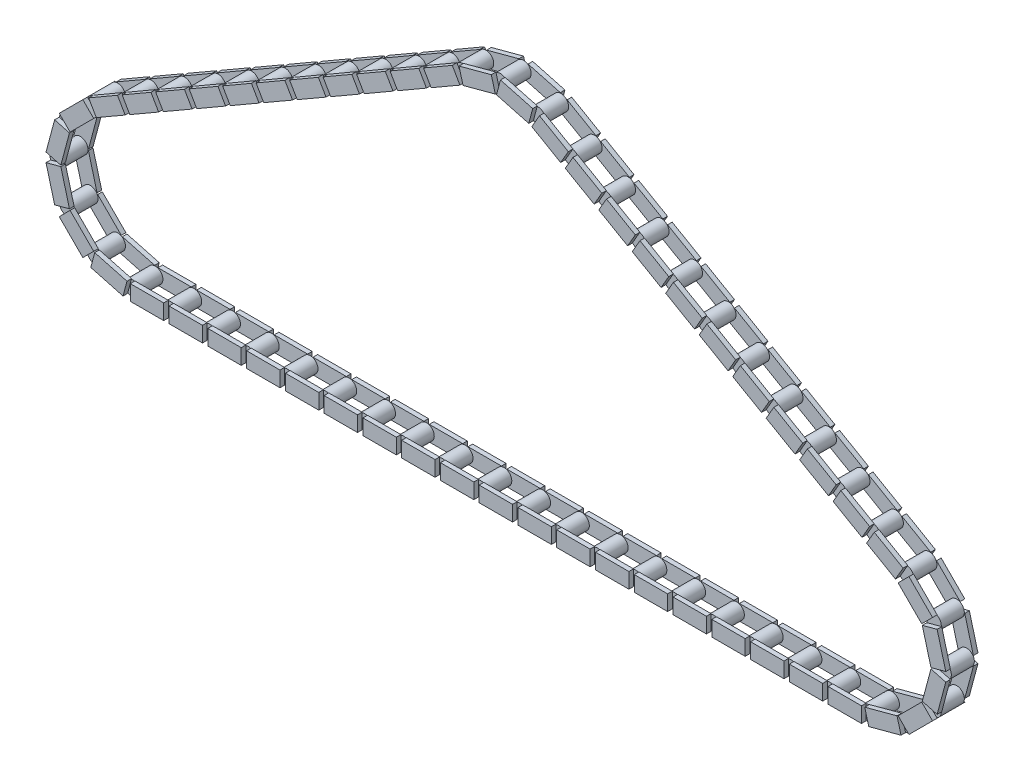
from build123d import *

# Parameters (mm, degrees)
BOTTOM_LINK_PLATES_DEPTH    = 1.2
BOTTOM_LINK_PLATES_2_DEPTH  = 1.2
BOTTOM_LINK_PLATES_3_DEPTH  = 1.2
BOTTOM_LINK_PLATES_4_DEPTH  = 1.2
BOTTOM_LINK_PLATES_5_DEPTH  = 1.2
BOTTOM_LINK_PLATES_6_DEPTH  = 1.2
BOTTOM_LINK_PLATES_7_DEPTH  = 1.2
BOTTOM_LINK_PLATES_8_DEPTH  = 1.2
BOTTOM_LINK_PLATES_9_DEPTH  = 1.2
BOTTOM_LINK_PLATES_10_DEPTH = 1.2
BOTTOM_LINK_PLATES_11_DEPTH = 1.2
BOTTOM_LINK_PLATES_12_DEPTH = 1.2
BOTTOM_LINK_PLATES_13_DEPTH = 1.2
BOTTOM_LINK_PLATES_14_DEPTH = 1.2
BOTTOM_LINK_PLATES_15_DEPTH = 1.2
BOTTOM_LINK_PLATES_16_DEPTH = 1.2
BOTTOM_LINK_PLATES_17_DEPTH = 1.2
BOTTOM_LINK_PLATES_18_DEPTH = 1.2
BOTTOM_LINK_PLATES_19_DEPTH = 1.2
BOTTOM_LINK_PLATES_20_DEPTH = 1.2
BOTTOM_LINK_PLATES_21_DEPTH = 1.2
BOTTOM_LINK_PLATES_22_DEPTH = 1.2
BOTTOM_LINK_PLATES_23_DEPTH = 1.2
BOTTOM_LINK_PLATES_24_DEPTH = 1.2
BOTTOM_LINK_PLATES_25_DEPTH = 1.2
BOTTOM_LINK_PLATES_26_DEPTH = 1.2
BOTTOM_LINK_PLATES_27_DEPTH = 1.2
BOTTOM_LINK_PLATES_28_DEPTH = 1.2
BOTTOM_LINK_PLATES_29_DEPTH = 1.2
BOTTOM_LINK_PLATES_30_DEPTH = 1.2
BOTTOM_LINK_PLATES_31_DEPTH = 1.2
BOTTOM_LINK_PLATES_32_DEPTH = 1.2
BOTTOM_LINK_PLATES_33_DEPTH = 1.2
BOTTOM_LINK_PLATES_34_DEPTH = 1.2
SKETCH_1_W                  = 8.705263365
SKETCH_1_H                  = 4
BOTTOM_LINK_PLATES_35_DEPTH = 1.2
BOTTOM_LINK_PLATES_36_DEPTH = 1.2
SKETCH_1_W_2                = 8.705263366
BOTTOM_LINK_PLATES_37_DEPTH = 1.2
BOTTOM_LINK_PLATES_38_DEPTH = 1.2
BOTTOM_LINK_PLATES_39_DEPTH = 1.2
BOTTOM_LINK_PLATES_40_DEPTH = 1.2
BOTTOM_LINK_PLATES_41_DEPTH = 1.2
BOTTOM_LINK_PLATES_42_DEPTH = 1.2
BOTTOM_LINK_PLATES_43_DEPTH = 1.2
BOTTOM_LINK_PLATES_44_DEPTH = 1.2
BOTTOM_LINK_PLATES_45_DEPTH = 1.2
BOTTOM_LINK_PLATES_46_DEPTH = 1.2
BOTTOM_LINK_PLATES_47_DEPTH = 1.2
BOTTOM_LINK_PLATES_48_DEPTH = 1.2
BOTTOM_LINK_PLATES_49_DEPTH = 1.2
BOTTOM_LINK_PLATES_50_DEPTH = 1.2
BOTTOM_LINK_PLATES_51_DEPTH = 1.2
BOTTOM_LINK_PLATES_52_DEPTH = 1.2
BOTTOM_LINK_PLATES_53_DEPTH = 1.2
SKETCH_3_R                  = 2
ROLLERS_DEPTH               = 6
SKETCH_5_W                  = 8.705263365
SKETCH_5_H                  = 4
SKETCH_5_W_2                = 8.705263366
TOP_LINK_PLATES_DEPTH       = 1.2


with BuildPart() as part:
    # 草图1 → Bottom_link_plates (new body)
    with BuildSketch(Plane.XY):
        Polygon((-97.193786169, -21.272547652), (-105.602424677, -19.019459754), (-104.567148497, -15.155756449), (-96.158509988, -17.408844347), align=None)
    extrude(amount=BOTTOM_LINK_PLATES_DEPTH)



with BuildPart() as body_2:
    # 草图1 → Bottom_link_plates 2 (new body)
    with BuildSketch(Plane.XY):
        Polygon((-107.670122975, -17.825673586), (-113.825673586, -11.670122975), (-110.997246461, -8.84169585), (-104.84169585, -14.997246461), align=None)
    extrude(amount=BOTTOM_LINK_PLATES_2_DEPTH)


with BuildPart() as body_3:
    # 草图1 → Bottom_link_plates 3 (new body)
    with BuildSketch(Plane.XY):
        Polygon((-115.019459754, -9.602424677), (-117.272547652, -1.193786169), (-113.408844347, -0.158509988), (-111.155756449, -8.567148497), align=None)
    extrude(amount=BOTTOM_LINK_PLATES_3_DEPTH)


with BuildPart() as body_4:
    # 草图1 → Bottom_link_plates 4 (new body)
    with BuildSketch(Plane.XY):
        Polygon((-117.272547652, 1.193786169), (-115.019459754, 9.602424677), (-111.155756449, 8.567148497), (-113.408844347, 0.158509988), align=None)
    extrude(amount=BOTTOM_LINK_PLATES_4_DEPTH)


with BuildPart() as body_5:
    # 草图1 → Bottom_link_plates 5 (new body)
    with BuildSketch(Plane.XY):
        Polygon((-113.825673586, 11.670122975), (-107.670122975, 17.825673586), (-104.84169585, 14.997246461), (-110.997246461, 8.84169585), align=None)
    extrude(amount=BOTTOM_LINK_PLATES_5_DEPTH)


with BuildPart() as body_6:
    # 草图1 → Bottom_link_plates 6 (new body)
    with BuildSketch(Plane.XY):
        Polygon((-106.154716463, 18.988485657), (-98.639879132, 23.32717699), (-96.639879831, 19.863074971), (-104.154717162, 15.524383638), align=None)
    extrude(amount=BOTTOM_LINK_PLATES_6_DEPTH)


with BuildPart() as body_7:
    # 草图1 → Bottom_link_plates 7 (new body)
    with BuildSketch(Plane.XY):
        Polygon((-97.427443425, 24.027176746), (-89.912606094, 28.365868079), (-87.912606794, 24.90176606), (-95.427444124, 20.563074727), align=None)
    extrude(amount=BOTTOM_LINK_PLATES_7_DEPTH)


with BuildPart() as body_8:
    # 草图1 → Bottom_link_plates 8 (new body)
    with BuildSketch(Plane.XY):
        Polygon((-88.700170388, 29.065867834), (-81.185333057, 33.404559167), (-79.185333756, 29.940457148), (-86.700171087, 25.601765815), align=None)
    extrude(amount=BOTTOM_LINK_PLATES_8_DEPTH)


with BuildPart() as body_9:
    # 草图1 → Bottom_link_plates 9 (new body)
    with BuildSketch(Plane.XY):
        Polygon((-79.97289735, 34.104558922), (-72.458060019, 38.443250255), (-70.458060718, 34.979148236), (-77.972898049, 30.640456903), align=None)
    extrude(amount=BOTTOM_LINK_PLATES_9_DEPTH)


with BuildPart() as body_10:
    # 草图1 → Bottom_link_plates 10 (new body)
    with BuildSketch(Plane.XY):
        Polygon((-71.245624312, 39.14325001), (-63.730786981, 43.481941343), (-61.730787681, 40.017839324), (-69.245625012, 35.679147991), align=None)
    extrude(amount=BOTTOM_LINK_PLATES_10_DEPTH)


with BuildPart() as body_11:
    # 草图1 → Bottom_link_plates 11 (new body)
    with BuildSketch(Plane.XY):
        Polygon((-62.518351275, 44.181941099), (-55.003513944, 48.520632432), (-53.003514643, 45.056530413), (-60.518351974, 40.71783908), align=None)
    extrude(amount=BOTTOM_LINK_PLATES_11_DEPTH)


with BuildPart() as body_12:
    # 草图1 → Bottom_link_plates 12 (new body)
    with BuildSketch(Plane.XY):
        Polygon((-53.791078237, 49.220632187), (-46.276240906, 53.55932352), (-44.276241606, 50.095221501), (-51.791078937, 45.756530168), align=None)
    extrude(amount=BOTTOM_LINK_PLATES_12_DEPTH)


with BuildPart() as body_13:
    # 草图1 → Bottom_link_plates 13 (new body)
    with BuildSketch(Plane.XY):
        Polygon((-45.0638052, 54.259323275), (-37.548967869, 58.598014608), (-35.548968568, 55.133912589), (-43.063805899, 50.795221256), align=None)
    extrude(amount=BOTTOM_LINK_PLATES_13_DEPTH)


with BuildPart() as body_14:
    # 草图1 → Bottom_link_plates 14 (new body)
    with BuildSketch(Plane.XY):
        Polygon((-36.336532162, 59.298014363), (-28.821694831, 63.636705696), (-26.821695531, 60.172603677), (-34.336532861, 55.833912344), align=None)
    extrude(amount=BOTTOM_LINK_PLATES_14_DEPTH)


with BuildPart() as body_15:
    # 草图1 → Bottom_link_plates 15 (new body)
    with BuildSketch(Plane.XY):
        Polygon((-27.609259125, 64.336705452), (-20.094421794, 68.675396785), (-18.094422493, 65.211294766), (-25.609259824, 60.872603433), align=None)
    extrude(amount=BOTTOM_LINK_PLATES_15_DEPTH)


with BuildPart() as body_16:
    # 草图1 → Bottom_link_plates 16 (new body)
    with BuildSketch(Plane.XY):
        Polygon((-18.881986087, 69.37539654), (-11.367148756, 73.714087873), (-9.367149455, 70.249985854), (-16.881986786, 65.911294521), align=None)
    extrude(amount=BOTTOM_LINK_PLATES_16_DEPTH)


with BuildPart() as body_17:
    # 草图1 → Bottom_link_plates 17 (new body)
    with BuildSketch(Plane.XY):
        Polygon((-9.602420838, 74.445061693), (-1.193781874, 76.698147893), (-0.158506473, 72.834444379), (-8.567145437, 70.581358179), align=None)
    extrude(amount=BOTTOM_LINK_PLATES_17_DEPTH)


with BuildPart() as body_18:
    # 草图1 → Bottom_link_plates 18 (new body)
    with BuildSketch(Plane.XY):
        Polygon((1.193790463, 76.698147411), (9.602428517, 74.445057816), (8.567151557, 70.58135472), (0.158513503, 72.834444315), align=None)
    extrude(amount=BOTTOM_LINK_PLATES_18_DEPTH)


with BuildPart() as body_19:
    # 草图1 → Bottom_link_plates 19 (new body)
    with BuildSketch(Plane.XY):
        Polygon((11.367155583, 73.714083931), (18.881991983, 69.375393136), (16.881992682, 65.911291117), (9.367156282, 70.249981913), align=None)
    extrude(amount=BOTTOM_LINK_PLATES_19_DEPTH)


with BuildPart() as body_20:
    # 草图1 → Bottom_link_plates 20 (new body)
    with BuildSketch(Plane.XY):
        Polygon((20.094427689, 68.675393381), (27.609264089, 64.336702585), (25.609264789, 60.872600566), (18.094428389, 65.211291362), align=None)
    extrude(amount=BOTTOM_LINK_PLATES_20_DEPTH)


with BuildPart() as body_21:
    # 草图1 → Bottom_link_plates 21 (new body)
    with BuildSketch(Plane.XY):
        Polygon((28.821699796, 63.63670283), (36.336536196, 59.298012034), (34.336536895, 55.833910015), (26.821700495, 60.172600811), align=None)
    extrude(amount=BOTTOM_LINK_PLATES_21_DEPTH)


with BuildPart() as body_22:
    # 草图1 → Bottom_link_plates 22 (new body)
    with BuildSketch(Plane.XY):
        Polygon((37.548971903, 58.598012279), (45.063808303, 54.259321484), (43.063809002, 50.795219465), (35.548972602, 55.13391026), align=None)
    extrude(amount=BOTTOM_LINK_PLATES_22_DEPTH)


with BuildPart() as body_23:
    # 草图1 → Bottom_link_plates 23 (new body)
    with BuildSketch(Plane.XY):
        Polygon((46.276244009, 53.559321728), (53.791080409, 49.220630933), (51.791081109, 45.756528914), (44.276244709, 50.095219709), align=None)
    extrude(amount=BOTTOM_LINK_PLATES_23_DEPTH)


with BuildPart() as body_24:
    # 草图1 → Bottom_link_plates 24 (new body)
    with BuildSketch(Plane.XY):
        Polygon((55.003516116, 48.520631178), (62.518352516, 44.181940382), (60.518353215, 40.717838363), (53.003516815, 45.056529159), align=None)
    extrude(amount=BOTTOM_LINK_PLATES_24_DEPTH)


with BuildPart() as body_25:
    # 草图1 → Bottom_link_plates 25 (new body)
    with BuildSketch(Plane.XY):
        Polygon((63.730788223, 43.481940627), (71.245624623, 39.143249831), (69.245625322, 35.679147812), (61.730788922, 40.017838608), align=None)
    extrude(amount=BOTTOM_LINK_PLATES_25_DEPTH)


with BuildPart() as body_26:
    # 草图1 → Bottom_link_plates 26 (new body)
    with BuildSketch(Plane.XY):
        Polygon((72.458060329, 38.443250076), (79.972896729, 34.10455928), (77.972897429, 30.640457261), (70.458061029, 34.979148057), align=None)
    extrude(amount=BOTTOM_LINK_PLATES_26_DEPTH)


with BuildPart() as body_27:
    # 草图1 → Bottom_link_plates 27 (new body)
    with BuildSketch(Plane.XY):
        Polygon((81.185332436, 33.404559525), (88.700168836, 29.06586873), (86.700169535, 25.601766711), (79.185333135, 29.940457506), align=None)
    extrude(amount=BOTTOM_LINK_PLATES_27_DEPTH)


with BuildPart() as body_28:
    # 草图1 → Bottom_link_plates 28 (new body)
    with BuildSketch(Plane.XY):
        Polygon((89.912604543, 28.365868974), (97.427440943, 24.027178179), (95.427441642, 20.56307616), (87.912605242, 24.901766955), align=None)
    extrude(amount=BOTTOM_LINK_PLATES_28_DEPTH)


with BuildPart() as body_29:
    # 草图1 → Bottom_link_plates 29 (new body)
    with BuildSketch(Plane.XY):
        Polygon((98.639876649, 23.327178424), (106.154713049, 18.988487628), (104.154713749, 15.524385609), (96.639877349, 19.863076405), align=None)
    extrude(amount=BOTTOM_LINK_PLATES_29_DEPTH)


with BuildPart() as body_30:
    # 草图1 → Bottom_link_plates 30 (new body)
    with BuildSketch(Plane.XY):
        Polygon((107.670119376, 17.825675942), (113.82567123, 11.670126574), (110.997244676, 8.841698878), (104.841692822, 14.997248246), align=None)
    extrude(amount=BOTTOM_LINK_PLATES_30_DEPTH)


with BuildPart() as body_31:
    # 草图1 → Bottom_link_plates 31 (new body)
    with BuildSketch(Plane.XY):
        Polygon((115.019457816, 9.602428517), (117.272547411, 1.193790463), (113.408844315, 0.158513503), (111.15575472, 8.567151557), align=None)
    extrude(amount=BOTTOM_LINK_PLATES_31_DEPTH)


with BuildPart() as body_32:
    # 草图1 → Bottom_link_plates 32 (new body)
    with BuildSketch(Plane.XY):
        Polygon((117.272547893, -1.193781874), (115.019461693, -9.602420838), (111.155758179, -8.567145437), (113.408844379, -0.158506473), align=None)
    extrude(amount=BOTTOM_LINK_PLATES_32_DEPTH)


with BuildPart() as body_33:
    # 草图1 → Bottom_link_plates 33 (new body)
    with BuildSketch(Plane.XY):
        Polygon((113.825675942, -11.670119376), (107.670126574, -17.82567123), (104.841698878, -14.997244676), (110.997248246, -8.841692822), align=None)
    extrude(amount=BOTTOM_LINK_PLATES_33_DEPTH)


with BuildPart() as body_34:
    # 草图1 → Bottom_link_plates 34 (new body)
    with BuildSketch(Plane.XY):
        Polygon((105.602428517, -19.019457816), (97.193790463, -21.272547411), (96.158513503, -17.408844315), (104.567151557, -15.15575472), align=None)
    extrude(amount=BOTTOM_LINK_PLATES_34_DEPTH)


with BuildPart() as body_35:
    # 草图1 → Bottom_link_plates 35 (new body)
    with BuildSketch(Plane.XY):
        with Locations((90.947372258, -19.521869331)):
            Rectangle(SKETCH_1_W, SKETCH_1_H)
    extrude(amount=BOTTOM_LINK_PLATES_35_DEPTH)


with BuildPart() as body_36:
    # 草图1 → Bottom_link_plates 36 (new body)
    with BuildSketch(Plane.XY):
        with Locations((80.842108894, -19.521869331)):
            Rectangle(SKETCH_1_W, SKETCH_1_H)
    extrude(amount=BOTTOM_LINK_PLATES_36_DEPTH)


with BuildPart() as body_37:
    # 草图1 → Bottom_link_plates 37 (new body)
    with BuildSketch(Plane.XY):
        with Locations((70.736845528, -19.521869331)):
            Rectangle(SKETCH_1_W_2, SKETCH_1_H)
    extrude(amount=BOTTOM_LINK_PLATES_37_DEPTH)


with BuildPart() as body_38:
    # 草图1 → Bottom_link_plates 38 (new body)
    with BuildSketch(Plane.XY):
        with Locations((60.631582163, -19.521869331)):
            Rectangle(SKETCH_1_W, SKETCH_1_H)
    extrude(amount=BOTTOM_LINK_PLATES_38_DEPTH)


with BuildPart() as body_39:
    # 草图1 → Bottom_link_plates 39 (new body)
    with BuildSketch(Plane.XY):
        with Locations((50.526318797, -19.521869331)):
            Rectangle(SKETCH_1_W, SKETCH_1_H)
    extrude(amount=BOTTOM_LINK_PLATES_39_DEPTH)


with BuildPart() as body_40:
    # 草图1 → Bottom_link_plates 40 (new body)
    with BuildSketch(Plane.XY):
        with Locations((40.421055432, -19.521869331)):
            Rectangle(SKETCH_1_W_2, SKETCH_1_H)
    extrude(amount=BOTTOM_LINK_PLATES_40_DEPTH)


with BuildPart() as body_41:
    # 草图1 → Bottom_link_plates 41 (new body)
    with BuildSketch(Plane.XY):
        with Locations((30.315792067, -19.521869331)):
            Rectangle(SKETCH_1_W, SKETCH_1_H)
    extrude(amount=BOTTOM_LINK_PLATES_41_DEPTH)


with BuildPart() as body_42:
    # 草图1 → Bottom_link_plates 42 (new body)
    with BuildSketch(Plane.XY):
        with Locations((20.210528702, -19.521869331)):
            Rectangle(SKETCH_1_W, SKETCH_1_H)
    extrude(amount=BOTTOM_LINK_PLATES_42_DEPTH)


with BuildPart() as body_43:
    # 草图1 → Bottom_link_plates 43 (new body)
    with BuildSketch(Plane.XY):
        with Locations((10.105265336, -19.521869331)):
            Rectangle(SKETCH_1_W_2, SKETCH_1_H)
    extrude(amount=BOTTOM_LINK_PLATES_43_DEPTH)


with BuildPart() as body_44:
    # 草图1 → Bottom_link_plates 44 (new body)
    with BuildSketch(Plane.XY):
        with Locations((1.971e-06, -19.521869331)):
            Rectangle(SKETCH_1_W, SKETCH_1_H)
    extrude(amount=BOTTOM_LINK_PLATES_44_DEPTH)


with BuildPart() as body_45:
    # 草图1 → Bottom_link_plates 45 (new body)
    with BuildSketch(Plane.XY):
        with Locations((-10.105261395, -19.521869331)):
            Rectangle(SKETCH_1_W, SKETCH_1_H)
    extrude(amount=BOTTOM_LINK_PLATES_45_DEPTH)


with BuildPart() as body_46:
    # 草图1 → Bottom_link_plates 46 (new body)
    with BuildSketch(Plane.XY):
        with Locations((-20.21052476, -19.521869331)):
            Rectangle(SKETCH_1_W_2, SKETCH_1_H)
    extrude(amount=BOTTOM_LINK_PLATES_46_DEPTH)


with BuildPart() as body_47:
    # 草图1 → Bottom_link_plates 47 (new body)
    with BuildSketch(Plane.XY):
        with Locations((-30.315788126, -19.521869331)):
            Rectangle(SKETCH_1_W, SKETCH_1_H)
    extrude(amount=BOTTOM_LINK_PLATES_47_DEPTH)


with BuildPart() as body_48:
    # 草图1 → Bottom_link_plates 48 (new body)
    with BuildSketch(Plane.XY):
        with Locations((-40.421051491, -19.521869331)):
            Rectangle(SKETCH_1_W, SKETCH_1_H)
    extrude(amount=BOTTOM_LINK_PLATES_48_DEPTH)


with BuildPart() as body_49:
    # 草图1 → Bottom_link_plates 49 (new body)
    with BuildSketch(Plane.XY):
        with Locations((-50.526314856, -19.521869331)):
            Rectangle(SKETCH_1_W_2, SKETCH_1_H)
    extrude(amount=BOTTOM_LINK_PLATES_49_DEPTH)


with BuildPart() as body_50:
    # 草图1 → Bottom_link_plates 50 (new body)
    with BuildSketch(Plane.XY):
        with Locations((-60.631578222, -19.521869331)):
            Rectangle(SKETCH_1_W, SKETCH_1_H)
    extrude(amount=BOTTOM_LINK_PLATES_50_DEPTH)


with BuildPart() as body_51:
    # 草图1 → Bottom_link_plates 51 (new body)
    with BuildSketch(Plane.XY):
        with Locations((-70.736841587, -19.521869331)):
            Rectangle(SKETCH_1_W, SKETCH_1_H)
    extrude(amount=BOTTOM_LINK_PLATES_51_DEPTH)


with BuildPart() as body_52:
    # 草图1 → Bottom_link_plates 52 (new body)
    with BuildSketch(Plane.XY):
        with Locations((-80.842104952, -19.521869331)):
            Rectangle(SKETCH_1_W_2, SKETCH_1_H)
    extrude(amount=BOTTOM_LINK_PLATES_52_DEPTH)


with BuildPart() as body_53:
    # 草图1 → Bottom_link_plates 53 (new body)
    with BuildSketch(Plane.XY):
        with Locations((-90.947368318, -19.521869331)):
            Rectangle(SKETCH_1_W, SKETCH_1_H)
    extrude(amount=BOTTOM_LINK_PLATES_53_DEPTH)


with BuildPart() as part_1:
    add(part.part)

    add(body_2.part)  # Rollers merges body 2

    add(body_3.part)  # Rollers merges body 3

    add(body_4.part)  # Rollers merges body 4

    add(body_5.part)  # Rollers merges body 5

    add(body_6.part)  # Rollers merges body 6

    add(body_7.part)  # Rollers merges body 7

    add(body_8.part)  # Rollers merges body 8

    add(body_9.part)  # Rollers merges body 9

    add(body_10.part)  # Rollers merges body 10

    add(body_11.part)  # Rollers merges body 11

    add(body_12.part)  # Rollers merges body 12

    add(body_13.part)  # Rollers merges body 13

    add(body_14.part)  # Rollers merges body 14

    add(body_15.part)  # Rollers merges body 15

    add(body_16.part)  # Rollers merges body 16

    add(body_17.part)  # Rollers merges body 17

    add(body_18.part)  # Rollers merges body 18

    add(body_19.part)  # Rollers merges body 19

    add(body_20.part)  # Rollers merges body 20

    add(body_21.part)  # Rollers merges body 21

    add(body_22.part)  # Rollers merges body 22

    add(body_23.part)  # Rollers merges body 23

    add(body_24.part)  # Rollers merges body 24

    add(body_25.part)  # Rollers merges body 25

    add(body_26.part)  # Rollers merges body 26

    add(body_27.part)  # Rollers merges body 27

    add(body_28.part)  # Rollers merges body 28

    add(body_29.part)  # Rollers merges body 29

    add(body_30.part)  # Rollers merges body 30

    add(body_31.part)  # Rollers merges body 31

    add(body_32.part)  # Rollers merges body 32

    add(body_33.part)  # Rollers merges body 33

    add(body_34.part)  # Rollers merges body 34

    add(body_35.part)  # Rollers merges body 35

    add(body_36.part)  # Rollers merges body 36

    add(body_37.part)  # Rollers merges body 37

    add(body_38.part)  # Rollers merges body 38

    add(body_39.part)  # Rollers merges body 39

    add(body_40.part)  # Rollers merges body 40

    add(body_41.part)  # Rollers merges body 41

    add(body_42.part)  # Rollers merges body 42

    add(body_43.part)  # Rollers merges body 43

    add(body_44.part)  # Rollers merges body 44

    add(body_45.part)  # Rollers merges body 45

    add(body_46.part)  # Rollers merges body 46

    add(body_47.part)  # Rollers merges body 47

    add(body_48.part)  # Rollers merges body 48

    add(body_49.part)  # Rollers merges body 49

    add(body_50.part)  # Rollers merges body 50

    add(body_51.part)  # Rollers merges body 51

    add(body_52.part)  # Rollers merges body 52

    add(body_53.part)  # Rollers merges body 53
    # 草图3 → Rollers (add)
    with BuildSketch(Plane.XY.offset(1.2)):
        with Locations((-96, -19.521869331)):
            Circle(SKETCH_3_R)
        with Locations((-105.760934666, -16.90643477)):
            Circle(SKETCH_3_R)
        with Locations((-112.90643477, -9.760934666)):
            Circle(SKETCH_3_R)
        with Locations((-115.521869331, 0)):
            Circle(SKETCH_3_R)
        with Locations((-112.90643477, 9.760934666)):
            Circle(SKETCH_3_R)
        with Locations((-105.760934666, 16.90643477)):
            Circle(SKETCH_3_R)
        with Locations((-97.033661628, 21.945125859)):
            Circle(SKETCH_3_R)
        with Locations((-88.306388591, 26.983816947)):
            Circle(SKETCH_3_R)
        with Locations((-79.579115553, 32.022508035)):
            Circle(SKETCH_3_R)
        with Locations((-70.851842515, 37.061199123)):
            Circle(SKETCH_3_R)
        with Locations((-62.124569478, 42.099890211)):
            Circle(SKETCH_3_R)
        with Locations((-53.39729644, 47.1385813)):
            Circle(SKETCH_3_R)
        with Locations((-44.670023403, 52.177272388)):
            Circle(SKETCH_3_R)
        with Locations((-35.942750365, 57.215963476)):
            Circle(SKETCH_3_R)
        with Locations((-27.215477328, 62.254654564)):
            Circle(SKETCH_3_R)
        with Locations((-18.48820429, 67.293345653)):
            Circle(SKETCH_3_R)
        with Locations((-9.760931252, 72.332036741)):
            Circle(SKETCH_3_R)
        with Locations((3.941e-06, 74.947469331)):
            Circle(SKETCH_3_R)
        with Locations((9.760938079, 72.3320328)):
            Circle(SKETCH_3_R)
        with Locations((18.488210186, 67.293342249)):
            Circle(SKETCH_3_R)
        with Locations((27.215482292, 62.254651698)):
            Circle(SKETCH_3_R)
        with Locations((35.942754399, 57.215961147)):
            Circle(SKETCH_3_R)
        with Locations((44.670026506, 52.177270596)):
            Circle(SKETCH_3_R)
        with Locations((53.397298612, 47.138580046)):
            Circle(SKETCH_3_R)
        with Locations((62.124570719, 42.099889495)):
            Circle(SKETCH_3_R)
        with Locations((70.851842826, 37.061198944)):
            Circle(SKETCH_3_R)
        with Locations((79.579114932, 32.022508393)):
            Circle(SKETCH_3_R)
        with Locations((88.306387039, 26.983817843)):
            Circle(SKETCH_3_R)
        with Locations((97.033659146, 21.945127292)):
            Circle(SKETCH_3_R)
        with Locations((105.760931252, 16.906436741)):
            Circle(SKETCH_3_R)
        with Locations((112.9064328, 9.760938079)):
            Circle(SKETCH_3_R)
        with Locations((115.521869331, 3.941e-06)):
            Circle(SKETCH_3_R)
        with Locations((112.906436741, -9.760931252)):
            Circle(SKETCH_3_R)
        with Locations((105.760938079, -16.9064328)):
            Circle(SKETCH_3_R)
        with Locations((96.000003941, -19.521869331)):
            Circle(SKETCH_3_R)
        with Locations((85.894740576, -19.521869331)):
            Circle(SKETCH_3_R)
        with Locations((75.789477211, -19.521869331)):
            Circle(SKETCH_3_R)
        with Locations((65.684213845, -19.521869331)):
            Circle(SKETCH_3_R)
        with Locations((55.57895048, -19.521869331)):
            Circle(SKETCH_3_R)
        with Locations((45.473687115, -19.521869331)):
            Circle(SKETCH_3_R)
        with Locations((35.368423749, -19.521869331)):
            Circle(SKETCH_3_R)
        with Locations((25.263160384, -19.521869331)):
            Circle(SKETCH_3_R)
        with Locations((15.157897019, -19.521869331)):
            Circle(SKETCH_3_R)
        with Locations((5.052633653, -19.521869331)):
            Circle(SKETCH_3_R)
        with Locations((-5.052629712, -19.521869331)):
            Circle(SKETCH_3_R)
        with Locations((-15.157893077, -19.521869331)):
            Circle(SKETCH_3_R)
        with Locations((-25.263156443, -19.521869331)):
            Circle(SKETCH_3_R)
        with Locations((-35.368419808, -19.521869331)):
            Circle(SKETCH_3_R)
        with Locations((-45.473683173, -19.521869331)):
            Circle(SKETCH_3_R)
        with Locations((-55.578946539, -19.521869331)):
            Circle(SKETCH_3_R)
        with Locations((-65.684209904, -19.521869331)):
            Circle(SKETCH_3_R)
        with Locations((-75.789473269, -19.521869331)):
            Circle(SKETCH_3_R)
        with Locations((-85.894736635, -19.521869331)):
            Circle(SKETCH_3_R)
    extrude(amount=ROLLERS_DEPTH)

    # 草图5 → Top_link_plates (add)
    with BuildSketch(Plane.XY.offset(7.2)):
        Polygon((-97.193786169, -21.272547652), (-105.602424677, -19.019459754), (-104.567148497, -15.155756449), (-96.158509988, -17.408844347), align=None)
        Polygon((-107.670122975, -17.825673586), (-113.825673586, -11.670122975), (-110.997246461, -8.84169585), (-104.84169585, -14.997246461), align=None)
        Polygon((-115.019459754, -9.602424677), (-117.272547652, -1.193786169), (-113.408844347, -0.158509988), (-111.155756449, -8.567148497), align=None)
        Polygon((-117.272547652, 1.193786169), (-115.019459754, 9.602424677), (-111.155756449, 8.567148497), (-113.408844347, 0.158509988), align=None)
        Polygon((-113.825673586, 11.670122975), (-107.670122975, 17.825673586), (-104.84169585, 14.997246461), (-110.997246461, 8.84169585), align=None)
        Polygon((-106.154716463, 18.988485657), (-98.639879132, 23.32717699), (-96.639879831, 19.863074971), (-104.154717162, 15.524383638), align=None)
        Polygon((-97.427443425, 24.027176746), (-89.912606094, 28.365868079), (-87.912606794, 24.90176606), (-95.427444124, 20.563074727), align=None)
        Polygon((-88.700170388, 29.065867834), (-81.185333057, 33.404559167), (-79.185333756, 29.940457148), (-86.700171087, 25.601765815), align=None)
        Polygon((-79.97289735, 34.104558922), (-72.458060019, 38.443250255), (-70.458060718, 34.979148236), (-77.972898049, 30.640456903), align=None)
        Polygon((-71.245624312, 39.14325001), (-63.730786981, 43.481941343), (-61.730787681, 40.017839324), (-69.245625012, 35.679147991), align=None)
        Polygon((-62.518351275, 44.181941099), (-55.003513944, 48.520632432), (-53.003514643, 45.056530413), (-60.518351974, 40.71783908), align=None)
        Polygon((-53.791078237, 49.220632187), (-46.276240906, 53.55932352), (-44.276241606, 50.095221501), (-51.791078937, 45.756530168), align=None)
        Polygon((-45.0638052, 54.259323275), (-37.548967869, 58.598014608), (-35.548968568, 55.133912589), (-43.063805899, 50.795221256), align=None)
        Polygon((-36.336532162, 59.298014363), (-28.821694831, 63.636705696), (-26.821695531, 60.172603677), (-34.336532861, 55.833912344), align=None)
        Polygon((-27.609259125, 64.336705452), (-20.094421794, 68.675396785), (-18.094422493, 65.211294766), (-25.609259824, 60.872603433), align=None)
        Polygon((-18.881986087, 69.37539654), (-11.367148756, 73.714087873), (-9.367149455, 70.249985854), (-16.881986786, 65.911294521), align=None)
        Polygon((-9.602420838, 74.445061693), (-1.193781874, 76.698147893), (-0.158506473, 72.834444379), (-8.567145437, 70.581358179), align=None)
        Polygon((1.193790463, 76.698147411), (9.602428517, 74.445057816), (8.567151557, 70.58135472), (0.158513503, 72.834444315), align=None)
        Polygon((11.367155583, 73.714083931), (18.881991983, 69.375393136), (16.881992682, 65.911291117), (9.367156282, 70.249981913), align=None)
        Polygon((20.094427689, 68.675393381), (27.609264089, 64.336702585), (25.609264789, 60.872600566), (18.094428389, 65.211291362), align=None)
        Polygon((28.821699796, 63.63670283), (36.336536196, 59.298012034), (34.336536895, 55.833910015), (26.821700495, 60.172600811), align=None)
        Polygon((37.548971903, 58.598012279), (45.063808303, 54.259321484), (43.063809002, 50.795219465), (35.548972602, 55.13391026), align=None)
        Polygon((46.276244009, 53.559321728), (53.791080409, 49.220630933), (51.791081109, 45.756528914), (44.276244709, 50.095219709), align=None)
        Polygon((55.003516116, 48.520631178), (62.518352516, 44.181940382), (60.518353215, 40.717838363), (53.003516815, 45.056529159), align=None)
        Polygon((63.730788223, 43.481940627), (71.245624623, 39.143249831), (69.245625322, 35.679147812), (61.730788922, 40.017838608), align=None)
        Polygon((72.458060329, 38.443250076), (79.972896729, 34.10455928), (77.972897429, 30.640457261), (70.458061029, 34.979148057), align=None)
        Polygon((81.185332436, 33.404559525), (88.700168836, 29.06586873), (86.700169535, 25.601766711), (79.185333135, 29.940457506), align=None)
        Polygon((89.912604543, 28.365868974), (97.427440943, 24.027178179), (95.427441642, 20.56307616), (87.912605242, 24.901766955), align=None)
        Polygon((98.639876649, 23.327178424), (106.154713049, 18.988487628), (104.154713749, 15.524385609), (96.639877349, 19.863076405), align=None)
        Polygon((107.670119376, 17.825675942), (113.82567123, 11.670126574), (110.997244676, 8.841698878), (104.841692822, 14.997248246), align=None)
        Polygon((115.019457816, 9.602428517), (117.272547411, 1.193790463), (113.408844315, 0.158513503), (111.15575472, 8.567151557), align=None)
        Polygon((117.272547893, -1.193781874), (115.019461693, -9.602420838), (111.155758179, -8.567145437), (113.408844379, -0.158506473), align=None)
        Polygon((113.825675942, -11.670119376), (107.670126574, -17.82567123), (104.841698878, -14.997244676), (110.997248246, -8.841692822), align=None)
        Polygon((105.602428517, -19.019457816), (97.193790463, -21.272547411), (96.158513503, -17.408844315), (104.567151557, -15.15575472), align=None)
        with Locations((90.947372258, -19.521869331)):
            Rectangle(SKETCH_5_W, SKETCH_5_H)
        with Locations((80.842108894, -19.521869331)):
            Rectangle(SKETCH_5_W, SKETCH_5_H)
        with Locations((70.736845528, -19.521869331)):
            Rectangle(SKETCH_5_W_2, SKETCH_5_H)
        with Locations((60.631582163, -19.521869331)):
            Rectangle(SKETCH_5_W, SKETCH_5_H)
        with Locations((50.526318797, -19.521869331)):
            Rectangle(SKETCH_5_W, SKETCH_5_H)
        with Locations((40.421055432, -19.521869331)):
            Rectangle(SKETCH_5_W_2, SKETCH_5_H)
        with Locations((30.315792067, -19.521869331)):
            Rectangle(SKETCH_5_W, SKETCH_5_H)
        with Locations((20.210528702, -19.521869331)):
            Rectangle(SKETCH_5_W, SKETCH_5_H)
        with Locations((10.105265336, -19.521869331)):
            Rectangle(SKETCH_5_W_2, SKETCH_5_H)
        with Locations((1.971e-06, -19.521869331)):
            Rectangle(SKETCH_5_W, SKETCH_5_H)
        with Locations((-10.105261395, -19.521869331)):
            Rectangle(SKETCH_5_W, SKETCH_5_H)
        with Locations((-20.21052476, -19.521869331)):
            Rectangle(SKETCH_5_W_2, SKETCH_5_H)
        with Locations((-30.315788126, -19.521869331)):
            Rectangle(SKETCH_5_W, SKETCH_5_H)
        with Locations((-40.421051491, -19.521869331)):
            Rectangle(SKETCH_5_W, SKETCH_5_H)
        with Locations((-50.526314856, -19.521869331)):
            Rectangle(SKETCH_5_W_2, SKETCH_5_H)
        with Locations((-60.631578222, -19.521869331)):
            Rectangle(SKETCH_5_W, SKETCH_5_H)
        with Locations((-70.736841587, -19.521869331)):
            Rectangle(SKETCH_5_W, SKETCH_5_H)
        with Locations((-80.842104952, -19.521869331)):
            Rectangle(SKETCH_5_W_2, SKETCH_5_H)
        with Locations((-90.947368318, -19.521869331)):
            Rectangle(SKETCH_5_W, SKETCH_5_H)
    extrude(amount=TOP_LINK_PLATES_DEPTH)


solid = part_1.part
